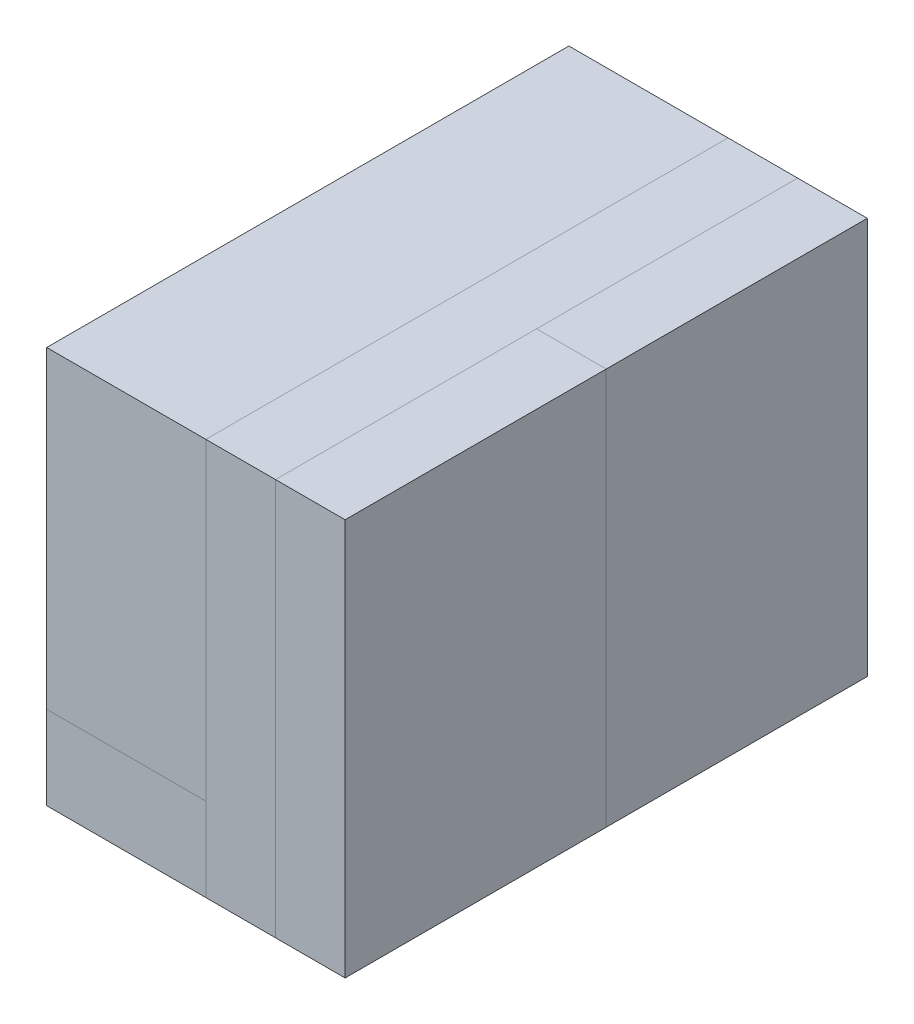
from build123d import *

# Parameters (mm, degrees)
SKETCH_1_W         = 228.6
SKETCH_1_H         = 750
EXTRUDE_444_DEPTH  = 120
SKETCH_3_W         = 228.6
SKETCH_3_H         = 750
EXTRUDE_18_DEPTH   = 450
SKETCH_5_W         = 750
SKETCH_5_H         = 570
EXTRUDE_2X_DEPTH   = 100
SKETCH_6_W         = 375
SKETCH_6_H         = 570
EXTRUDE_1X_DEPTH   = 100
SKETCH_7_W         = 375
SKETCH_7_H         = 570
EXTRUDE_1010_DEPTH = 100


with BuildPart() as part:
    # 草图1 → Extrude 444 (new body)
    with BuildSketch(Plane(origin=(0, 0, 0), x_dir=(1, 0, 0), z_dir=(0, 1, 0))):
        with Locations((114.3, 375)):
            Rectangle(SKETCH_1_W, SKETCH_1_H)
    extrude(amount=EXTRUDE_444_DEPTH)


with BuildPart() as body_2:
    # 草图3 → 18寸墙体 (new body)
    with BuildSketch(Plane(origin=(0, 120, 0), x_dir=(1, 0, 0), z_dir=(0, 1, 0))):
        with Locations((114.3, 375)):
            Rectangle(SKETCH_3_W, SKETCH_3_H)
    extrude(amount=EXTRUDE_18_DEPTH)


with BuildPart() as body_3:
    # 草图5 → 2x液晶挂壁 (new body)
    with BuildSketch(Plane(origin=(228.6, 0, 0), x_dir=(0, 0, -1), z_dir=(1, 0, 0))):
        with Locations((375, 285)):
            Rectangle(SKETCH_5_W, SKETCH_5_H)
    extrude(amount=EXTRUDE_2X_DEPTH)


with BuildPart() as body_4:
    # 草图6 → 1x液晶显示器 (new body)
    with BuildSketch(Plane(origin=(328.6, 0, 0), x_dir=(0, 0, -1), z_dir=(1, 0, 0))):
        with Locations((187.5, 285)):
            Rectangle(SKETCH_6_W, SKETCH_6_H)
    extrude(amount=EXTRUDE_1X_DEPTH)


with BuildPart() as body_5:
    # 草图7 → Extrude 1010 (new body)
    with BuildSketch(Plane(origin=(328.6, 0, 0), x_dir=(0, 0, -1), z_dir=(1, 0, 0))):
        with Locations((562.5, 285)):
            Rectangle(SKETCH_7_W, SKETCH_7_H)
    extrude(amount=EXTRUDE_1010_DEPTH)


solid = Compound([part.part, body_2.part, body_3.part, body_4.part, body_5.part])
